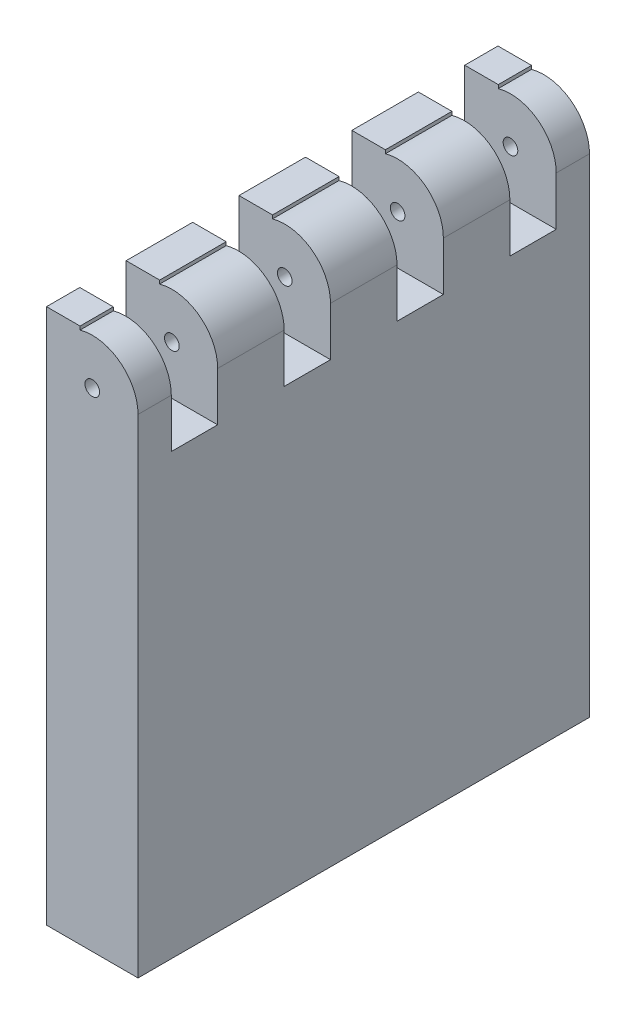
from build123d import *

# Parameters (mm, degrees)
BOSS_EXTRUDE1_DEPTH     = 37
SKETCH2_W               = 5.5
SKETCH2_H               = 7.8
BOSS_EXTRUDE2_DEPTH     = 37
CUT_EXTRUDE1_DEPTH      = 89.460443137
CUT_EXTRUDE1_DEPTH_BACK = 89.460443137
SKETCH3_W               = 7.6
SKETCH3_H               = 17
CUT_EXTRUDE2_DEPTH      = 89.460443137
CUT_EXTRUDE2_DEPTH_BACK = 89.460443137
SKETCH4_R               = 1.2


with BuildPart() as part:
    # Sketch1 → Boss-Extrude1 (new, symmetric)
    with BuildSketch(Plane.XY):
        with BuildLine():
            Line((7.5, 0), (7.5, -80))
            Line((7.5, -80), (-7.5, -80))
            Line((-7.5, -80), (-7.5, 0))
            ThreePointArc((-7.5, 0), (0, 7.5), (7.5, 0))
        make_face()
    extrude(amount=BOSS_EXTRUDE1_DEPTH, both=True)

    # Sketch2 → Boss-Extrude2 (add, symmetric)
    with BuildSketch(Plane.XY):
        with Locations((-4.75, 3.9)):
            Rectangle(SKETCH2_W, SKETCH2_H)
    extrude(amount=BOSS_EXTRUDE2_DEPTH, both=True)

    # Sketch3 → Cut-Extrude1 (cut, two sides: drawn at the far end of the back side and taken through both)
    with BuildSketch(Plane(origin=(0, 0, 0), x_dir=(0, 0, -1), z_dir=(1, 0, 0)).offset(-CUT_EXTRUDE1_DEPTH_BACK)):
        with Locations((-9.25, 0.5)):
            Rectangle(SKETCH3_W, SKETCH3_H)
        with Locations((-27.75, 0.5)):
            Rectangle(SKETCH3_W, SKETCH3_H)
        with Locations((27.75, 0.5)):
            Rectangle(SKETCH3_W, SKETCH3_H)
        with Locations((9.25, 0.5)):
            Rectangle(SKETCH3_W, SKETCH3_H)
    extrude(amount=CUT_EXTRUDE1_DEPTH + CUT_EXTRUDE1_DEPTH_BACK, mode=Mode.SUBTRACT)

    # Sketch4 → Cut-Extrude2 (cut, two sides: drawn at the far end of the back side and taken through both)
    with BuildSketch(Plane.XY.offset(-CUT_EXTRUDE2_DEPTH_BACK)):
        Circle(SKETCH4_R)
    extrude(amount=CUT_EXTRUDE2_DEPTH + CUT_EXTRUDE2_DEPTH_BACK, mode=Mode.SUBTRACT)


solid = part.part
